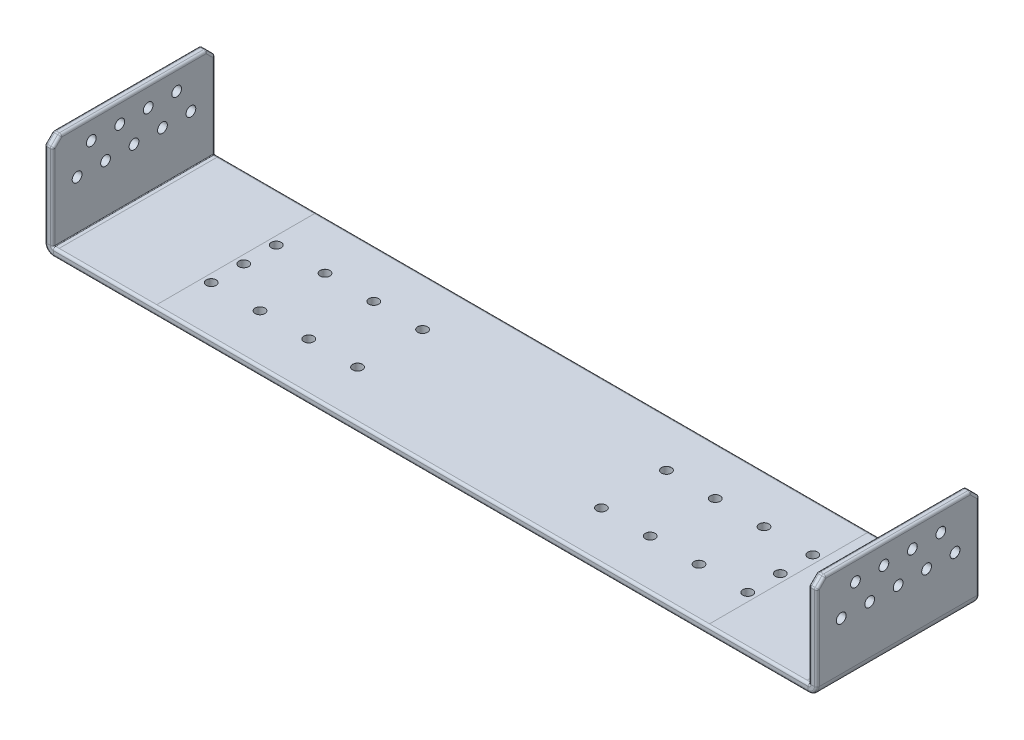
from build123d import *

# Parameters (mm, degrees)
SKETCH1_W                       = 950
SKETCH1_H                       = 200
BASE_FLANGE1_DEPTH              = 10
EDGE_FLANGE1_STRIP_W            = 41.4732
EDGE_FLANGE1_STRIP_H            = 10
EDGE_FLANGE1_STRIP_CUT_DEPTH    = 200
EDGE_FLANGE1_STRIP_2_W          = 41.4732
EDGE_FLANGE1_STRIP_2_H          = 10
EDGE_FLANGE1_STRIP_CUT_2_DEPTH  = 200
EDGE_FLANGE1_DEPTH              = 200
EDGE_FLANGE1_BEND_DEPTH         = 200
BREAK_CORNER1_START             = -475
BREAK_CORNER1_DEPTH             = 950
M10_CLEARANCE_HOLE1_D           = 12
M10_CLEARANCE_HOLE1_CSINK_D     = 12.05
M10_CLEARANCE_HOLE1_CSINK_ANGLE = 90
M10_CLEARANCE_HOLE2_D           = 12
M10_CLEARANCE_HOLE2_CSINK_D     = 12.05
M10_CLEARANCE_HOLE2_CSINK_ANGLE = 90
FILLET1_R                       = 3


# Read off the part's stored shape, not the designer's step: Break-Corner1
# Sheet-metal steps are written as plain solids
with BuildPart() as part:
    # Sketch1 → Base-Flange1 (new body)
    with BuildSketch(Plane(origin=(0, 0, 0), x_dir=(1, 0, 0), z_dir=(0, 1, 0))):
        Rectangle(SKETCH1_W, SKETCH1_H)
    extrude(amount=-BASE_FLANGE1_DEPTH)

    # Edge-Flange1 strip (across the edge) → Edge-Flange1 strip cut (cut)
    with BuildSketch(Plane(origin=(-475, 0, -100), x_dir=(1, 0, 0), z_dir=(0, 0, 1))):
        with Locations((-10, -5)):
            Rectangle(EDGE_FLANGE1_STRIP_W, EDGE_FLANGE1_STRIP_H)
    extrude(amount=EDGE_FLANGE1_STRIP_CUT_DEPTH, mode=Mode.SUBTRACT)

    # Edge-Flange1 strip 2 (across the edge) → Edge-Flange1 strip cut 2 (cut)
    with BuildSketch(Plane(origin=(475, 0, 100), x_dir=(-1, 0, 0), z_dir=(0, 0, -1))):
        with Locations((-10, -5)):
            Rectangle(EDGE_FLANGE1_STRIP_2_W, EDGE_FLANGE1_STRIP_2_H)
    extrude(amount=EDGE_FLANGE1_STRIP_CUT_2_DEPTH, mode=Mode.SUBTRACT)

    # Edge-Flange1 section (across the edge) → Edge-Flange1 (add)
    with BuildSketch(Plane(origin=(-475, 0, -100), x_dir=(1, 0, 0), z_dir=(0, 0, 1))):
        with BuildLine():
            Line((0, 0.7366), (0, 115))
            Line((0, 115), (10, 115))
            Line((10, 115), (10, 0.7366))
            ThreePointArc((10, 0.7366), (10.215745145, 0.215745145), (10.7366, 0))
            Line((10.7366, 0), (10.7366, -10))
            ThreePointArc((10.7366, -10), (3.144677333, -6.855322667), (0, 0.7366))
        make_face()
    extrude(amount=EDGE_FLANGE1_DEPTH)

    # Edge-Flange1 section 2 (across the edge) → Edge-Flange1 bend (add)
    with BuildSketch(Plane(origin=(475, 0, 100), x_dir=(-1, 0, 0), z_dir=(0, 0, -1))):
        with BuildLine():
            Line((0, 0.7366), (0, 115))
            Line((0, 115), (10, 115))
            Line((10, 115), (10, 0.7366))
            ThreePointArc((10, 0.7366), (10.215745145, 0.215745145), (10.7366, 0))
            Line((10.7366, 0), (10.7366, -10))
            ThreePointArc((10.7366, -10), (3.144677333, -6.855322667), (0, 0.7366))
        make_face()
    extrude(amount=EDGE_FLANGE1_BEND_DEPTH)

    # Break-Corner1 outline → Break-Corner1 (cut)
    with BuildSketch(Plane.YZ.offset(BREAK_CORNER1_START)):
        Polygon((115, 100), (105, 100), (115, 90), align=None)
        Polygon((115, -100), (115, -90), (105, -100), align=None)
    extrude(amount=BREAK_CORNER1_DEPTH, mode=Mode.SUBTRACT)

    # M10 Clearance Hole1 (through all)
    with Locations(Plane(origin=(475, 60, -70), x_dir=(0, 1, 0), z_dir=(1, 0, 0))):
        with Locations((0, 0), (0, 35), (0, 70), (0, 105), (0, 140), (30, 17.5), (30, 52.5), (30, 87.5), (30, 122.5)):
            CounterSinkHole(M10_CLEARANCE_HOLE1_D / 2, M10_CLEARANCE_HOLE1_CSINK_D / 2, counter_sink_angle=M10_CLEARANCE_HOLE1_CSINK_ANGLE)

    # M10 Clearance Hole2 (through all)
    with Locations(Plane(origin=(0, 0, 0), x_dir=(1, 0, 0), z_dir=(0, 1, 0))):
        with Locations((330, 40), (270, 40), (210, 40), (150, 40), (330, 0), (330, -40), (270, -40), (210, -40), (150, -40)):
            m10_clearance_hole2 = CounterSinkHole(M10_CLEARANCE_HOLE2_D / 2, M10_CLEARANCE_HOLE2_CSINK_D / 2, counter_sink_angle=M10_CLEARANCE_HOLE2_CSINK_ANGLE)

    # Mirror1: M10 Clearance Hole2 across plane
    add(m10_clearance_hole2.mirror(Plane(origin=(0, 0, 0), x_dir=(0, 0, 1), z_dir=(1, 0, 0))), mode=Mode.SUBTRACT)

    # Fillet1
    fillet1_edges = [part.edges().sort_by_distance(p)[0] for p in [
        (465, 110, 95),
        (470, 115, 90),
        (475, 110, 95),
        (0, 0, 100),
        (0, -10, 100),
        (0, 0, -100),
        (0, -10, -100),
        (-471.855322667, -6.855322667, -100),
        (-471.855322667, -6.855322667, 100),
        (-464.784254855, 0.215745145, -100),
        (-464.784254855, 0.215745145, 100),
        (-465, 52.8683, 100),
        (-475, 52.8683, 100),
        (471.855322667, -6.855322667, 100),
        (471.855322667, -6.855322667, -100),
        (464.784254855, 0.215745145, 100),
        (464.784254855, 0.215745145, -100),
        (465, 52.8683, -100),
        (475, 52.8683, -100),
        (-465, 115, 0),
        (-475, 115, 0),
        (-470, 115, 90),
        (-465, 110, 95),
        (-470, 105, 100),
        (-475, 110, 95),
        (-475, 52.8683, -100),
        (-465, 52.8683, -100),
        (-470, 105, -100),
        (-465, 110, -95),
        (-470, 115, -90),
        (-475, 110, -95),
        (465, 115, 0),
        (475, 115, 0),
        (470, 115, -90),
        (465, 110, -95),
        (470, 105, -100),
        (475, 110, -95),
        (475, 52.8683, 100),
        (465, 52.8683, 100),
        (470, 105, 100),
    ]]
    fillet(fillet1_edges, radius=FILLET1_R)


solid = part.part
